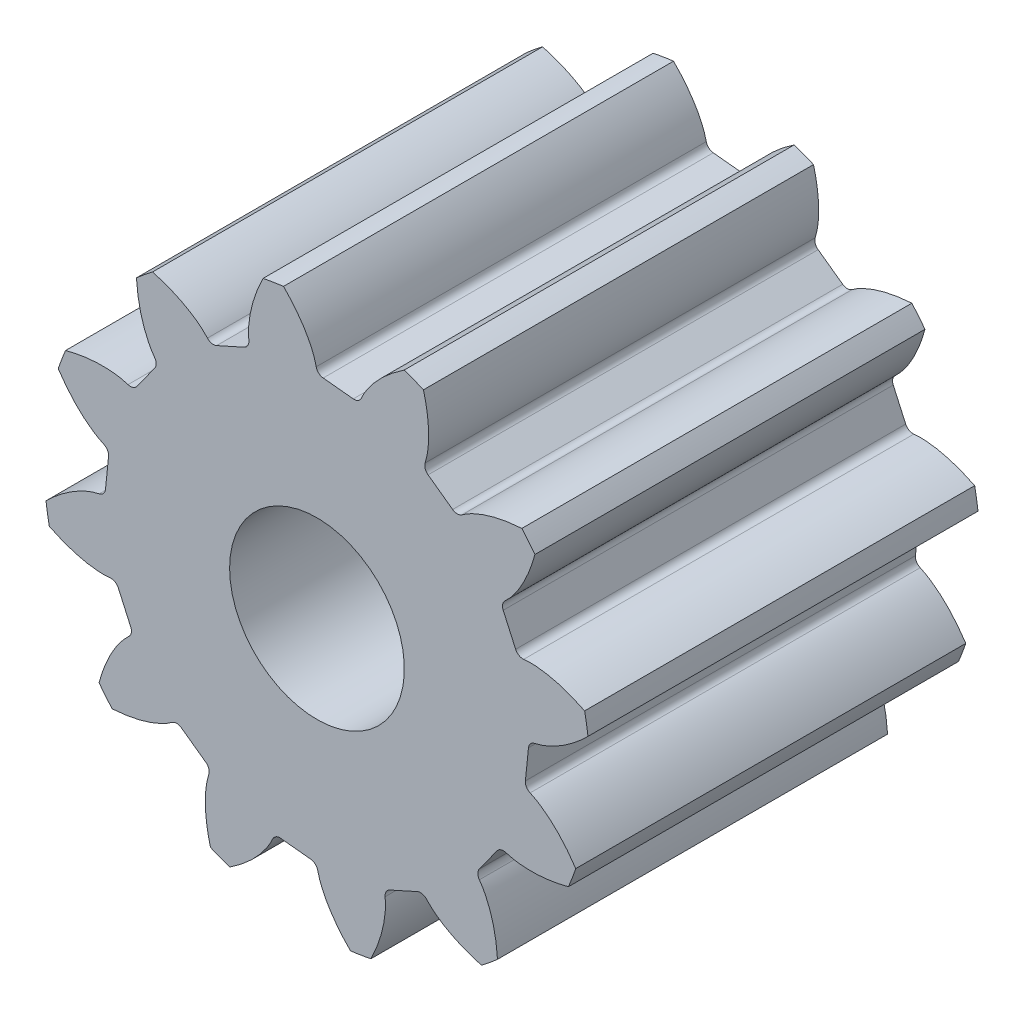
from build123d import *

# Parameters (mm, degrees)
SKETCH2_R                = 8.75
BOSS_EXTRUDE1_DEPTH      = 12.5
CUT_EXTRUDE1_DEPTH       = 12.5
FILLET1_R                = 0.254
CIRPATTERN3_COUNT        = 12
FILLET1_OF_CIRPATTERN3_R = 0.254
SKETCH3_R                = 2.8
CUT_EXTRUDE2_DEPTH       = 18.52349863


# Read off the part's stored shape, not the designer's step: Cut-Extrude1
with BuildPart() as part:
    # Sketch2 → Boss-Extrude1 (new body)
    with BuildSketch(Plane.XY):
        Circle(SKETCH2_R)
    extrude(amount=BOSS_EXTRUDE1_DEPTH)

    # Cut-Extrude1 outline → Cut-Extrude1 (cut)
    with BuildSketch(Plane.XY):
        with BuildLine():
            add(Edge.make_bspline(
                [(6.797308403, 0), (6.8023348, 0), (6.816428595, 0.000329253), (6.843042275, 0.002251617), (6.886329015, 0.007230219), (6.941206543, 0.016271417), (7.011684162, 0.031037634), (7.094002997, 0.052368294), (7.183571327, 0.079899179), (7.27988857, 0.114216931), (7.374857604, 0.15227734), (7.468437019, 0.193759208), (7.560540459, 0.238226646), (7.670670378, 0.295750856), (7.800651656, 0.369788193), (7.949250633, 0.463529873), (8.113618341, 0.578230279), (8.276265322, 0.703810094), (8.432169053, 0.834434516), (8.55379823, 0.946006139), (8.633878385, 1.023025806), (8.67701574, 1.065890601), (8.683979452, 1.072847087)],
                knots=[0, 0, 0, 0, 0, 0.005376748, 0.015083688, 0.02853182, 0.046610139, 0.064854849, 0.092110525, 0.119476175, 0.146842495, 0.174208853, 0.201574955, 0.228941013, 0.256307345, 0.307035032, 0.361767351, 0.41649966, 0.471231936, 0.525964281, 0.580696615, 0.591250757, 0.591250757, 0.591250757, 0.591250757, 0.591250757], degree=4))
            Line((6.797308403, 0), (6.65930689, -1.362730077))
            add(Edge.make_bspline(
                [(8.292588752, -2.79203721), (8.287161062, -2.783825866), (8.253493068, -2.733183115), (8.190479698, -2.641672594), (8.093687854, -2.507981821), (7.967137033, -2.348753675), (7.832968519, -2.193115826), (7.694933099, -2.047791534), (7.568144445, -1.926161787), (7.455645163, -1.827568828), (7.359283645, -1.749133557), (7.277964992, -1.68710394), (7.194601782, -1.627703372), (7.109191228, -1.571376209), (7.021709505, -1.518445428), (6.93947904, -1.473516751), (6.863107861, -1.436115805), (6.797021449, -1.407519966), (6.745070652, -1.387660433), (6.70366085, -1.374104746), (6.677972888, -1.366885878), (6.664231239, -1.363737773), (6.65930689, -1.362730077)],
                knots=[0.317840159, 0.317840159, 0.317840159, 0.317840159, 0.317840159, 0.328394301, 0.383126635, 0.43785898, 0.492591256, 0.547323565, 0.602055884, 0.652783571, 0.680149903, 0.707515961, 0.734882063, 0.762248421, 0.789614741, 0.816980391, 0.844236067, 0.862480777, 0.880559096, 0.894007228, 0.903714168, 0.909090916, 0.909090916, 0.909090916, 0.909090916, 0.909090916], degree=4))
            ThreePointArc((8.292588752, -2.79203721), (8.705475269, -0.881589666), (8.683979452, 1.072847087))
        make_face()
    cut_extrude1 = extrude(amount=CUT_EXTRUDE1_DEPTH, mode=Mode.SUBTRACT)

    # Fillet1
    fillet1_edges = [part.edges().sort_by_distance(p)[0] for p in [
        (6.65930689, -1.362730077, 6.25),
        (6.797308403, 0, 6.25),
    ]]
    fillet(fillet1_edges, radius=FILLET1_R)

    # CirPattern3: Cut-Extrude1 ×12 about axis
    cirpattern3_axis = Axis((0, 0, 18.908609159), (0, 0, -1))
    for i in range(1, CIRPATTERN3_COUNT):
        add(cut_extrude1.rotate(cirpattern3_axis, i * 360 / CIRPATTERN3_COUNT), mode=Mode.SUBTRACT)

    # Fillet1 of CirPattern3
    fillet1_of_cirpattern3_edges = [part.edges().sort_by_distance(p)[0] for p in [
        (5.0857639, -4.50981231, 6.25),
        (5.886641754, -3.398654201, 6.25),
        (2.14949458, -6.448493977, 6.25),
        (3.398654202, -5.886641754, 6.25),
        (-1.362730077, -6.65930689, 6.25),
        (0, -6.797308403, 6.25),
        (-4.50981231, -5.0857639, 6.25),
        (-3.398654201, -5.886641754, 6.25),
        (-6.448493977, -2.14949458, 6.25),
        (-5.886641754, -3.398654201, 6.25),
        (-6.65930689, 1.362730077, 6.25),
        (-6.797308403, 0, 6.25),
        (-5.0857639, 4.50981231, 6.25),
        (-5.886641754, 3.398654202, 6.25),
        (-2.14949458, 6.448493977, 6.25),
        (-3.398654202, 5.886641754, 6.25),
        (1.362730077, 6.65930689, 6.25),
        (0, 6.797308403, 6.25),
        (4.50981231, 5.0857639, 6.25),
        (3.398654202, 5.886641754, 6.25),
        (6.448493977, 2.14949458, 6.25),
        (5.886641754, 3.398654202, 6.25),
    ]]
    fillet(fillet1_of_cirpattern3_edges, radius=FILLET1_OF_CIRPATTERN3_R)

    # Sketch3 → Cut-Extrude2 (cut, through all)
    with BuildSketch(Plane(origin=(0, 0, 0), x_dir=(-1, 0, 0), z_dir=(0, 0, -1))):
        Circle(SKETCH3_R)
    extrude(amount=-CUT_EXTRUDE2_DEPTH, mode=Mode.SUBTRACT)


solid = part.part
